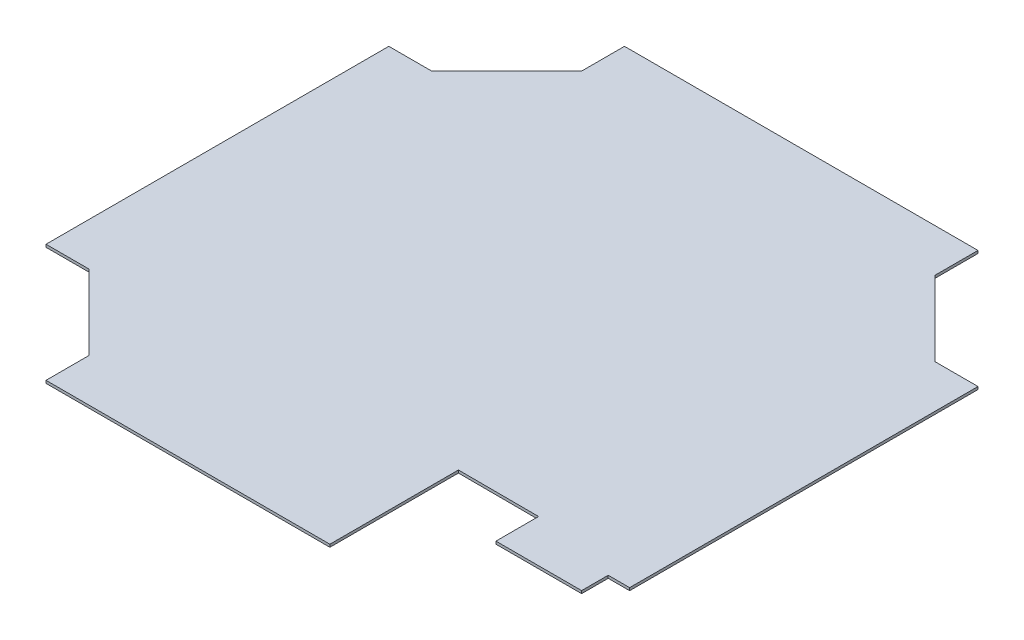
from build123d import *

# Parameters (mm, degrees)
SKETCH1_W           = 698.5
SKETCH1_H           = 685.8
BOSS_EXTRUDE1_DEPTH = 3.175
CUT_EXTRUDE1_DEPTH  = 490.454853
CUT_EXTRUDE2_DEPTH  = 494.999522325


with BuildPart() as part:
    # Sketch1 → Boss-Extrude1 (new body)
    with BuildSketch(Plane(origin=(0, 0, 0), x_dir=(1, 0, 0), z_dir=(0, 1, 0))):
        Rectangle(SKETCH1_W, SKETCH1_H)
    extrude(amount=BOSS_EXTRUDE1_DEPTH)

    # Sketch3 → Cut-Extrude1 (cut, through all)
    with BuildSketch(Plane(origin=(0, 3.175, 0), x_dir=(1, 0, 0), z_dir=(0, 1, 0))):
        Polygon((-298.45, 203.2), (-209.55, 292.1), (-209.55, 342.9), (-349.25, 342.9), (-349.25, 203.2), align=None)
        Polygon((-349.25, -203.2), (-298.45, -203.2), (-209.55, -292.1), (-209.55, -342.9), (-349.25, -342.9), align=None)
        Polygon((349.25, 203.2), (298.45, 203.2), (209.55, 292.1), (209.55, 342.9), (349.25, 342.9), align=None)
    extrude(amount=-CUT_EXTRUDE1_DEPTH, mode=Mode.SUBTRACT)

    # Sketch7 → Cut-Extrude2 (cut, through all)
    with BuildSketch(Plane(origin=(-6.096, 3.175, 0.254), x_dir=(1, 0, 0), z_dir=(0, 1, 0))):
        Polygon((133.096, -190.246), (133.096, -355.346), (368.046, -355.346), (368.046, -209.55), (329.946, -209.55), (329.946, -241.046), (228.346, -241.046), (228.346, -190.5), align=None)
    extrude(amount=-CUT_EXTRUDE2_DEPTH, mode=Mode.SUBTRACT)


solid = part.part
